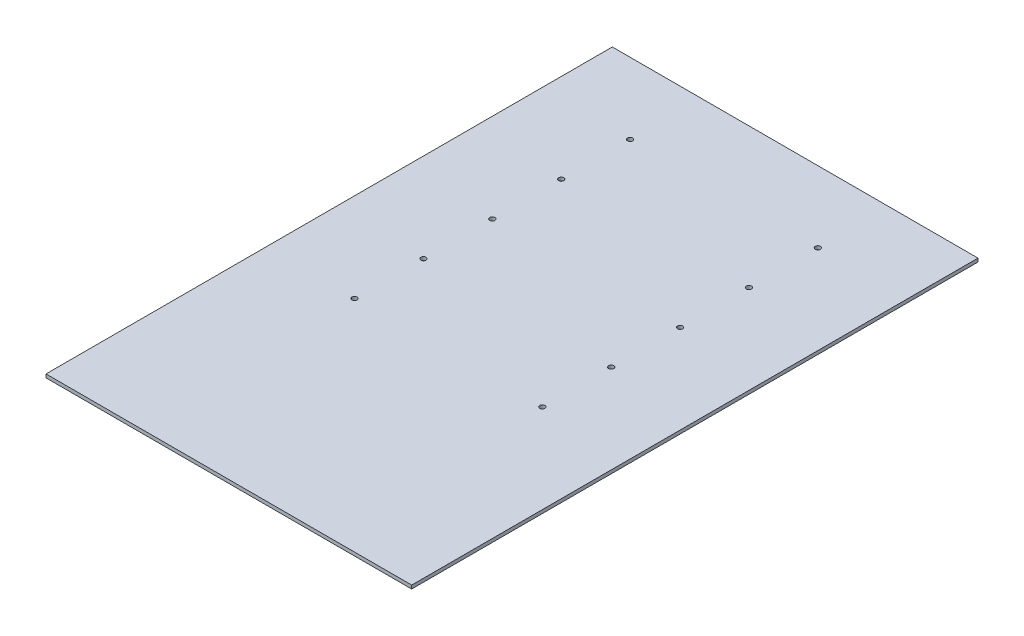
from build123d import *

# Parameters (mm, degrees)
SKETCH_1_W      = 318.56
SKETCH_1_H      = 493.33
SKETCH_1_R      = 2.25
EXTRUDE_1_DEPTH = 3


with BuildPart() as part:
    # 草图1 → 凸台-拉伸1 (new body)
    with BuildSketch(Plane(origin=(0, 0, 0), x_dir=(1, 0, 0), z_dir=(0, 1, 0))):
        Rectangle(SKETCH_1_W, SKETCH_1_H)
        with Locations((81.78, 184.660684134)):
            Circle(SKETCH_1_R, mode=Mode.SUBTRACT)
        with Locations((81.78, 124.660684134)):
            Circle(SKETCH_1_R, mode=Mode.SUBTRACT)
        with Locations((81.78, 64.660684134)):
            Circle(SKETCH_1_R, mode=Mode.SUBTRACT)
        with Locations((81.78, -55.339315866)):
            Circle(SKETCH_1_R, mode=Mode.SUBTRACT)
        with Locations((81.78, 4.660684134)):
            Circle(SKETCH_1_R, mode=Mode.SUBTRACT)
        with Locations((-81.78, -55.339315866)):
            Circle(SKETCH_1_R, mode=Mode.SUBTRACT)
        with Locations((-81.78, 4.660684134)):
            Circle(SKETCH_1_R, mode=Mode.SUBTRACT)
        with Locations((-81.78, 64.660684134)):
            Circle(SKETCH_1_R, mode=Mode.SUBTRACT)
        with Locations((-81.78, 124.660684134)):
            Circle(SKETCH_1_R, mode=Mode.SUBTRACT)
        with Locations((-81.78, 184.660684134)):
            Circle(SKETCH_1_R, mode=Mode.SUBTRACT)
    extrude(amount=EXTRUDE_1_DEPTH)


solid = part.part
